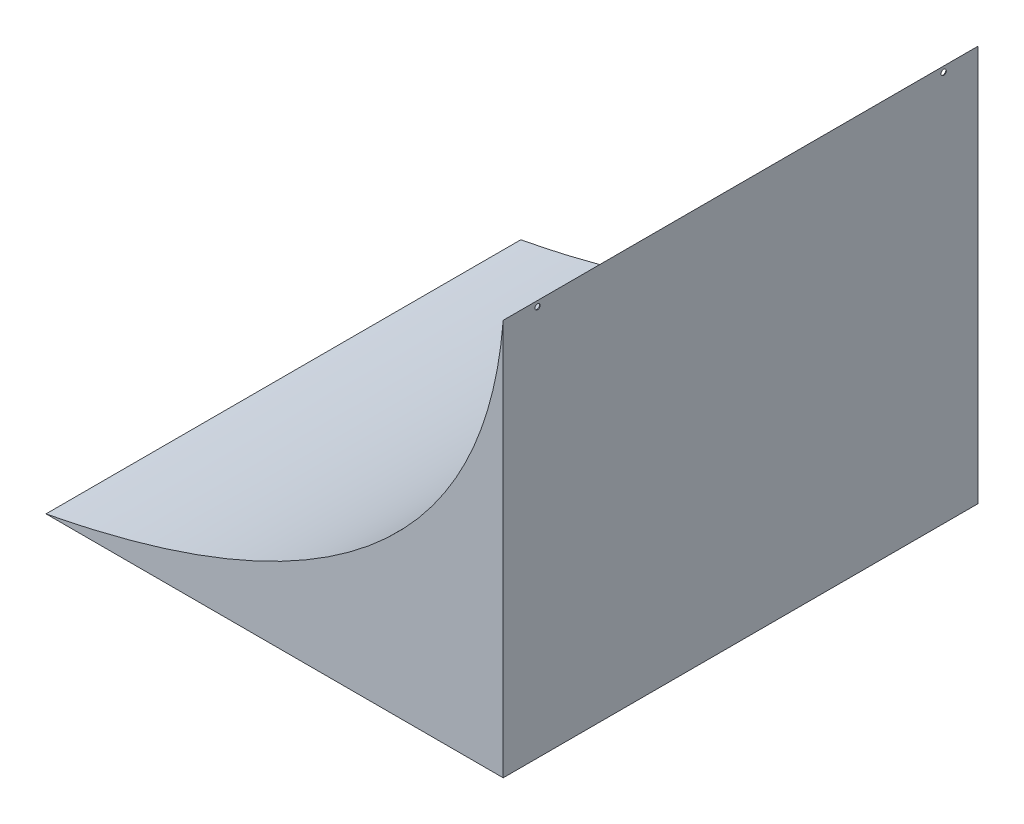
from build123d import *

# Parameters (mm, degrees)
SALIENTE_EXTRUIR1_DEPTH = 270


with BuildPart() as part:
    # Croquis1 → Saliente-Extruir1 (new body)
    with BuildSketch(Plane.XY):
        with BuildLine():
            Line((100.713061676, 115.894152269), (100.713061676, -109.438674176))
            Line((100.713061676, -109.438674176), (-159.286938324, -109.438674176))
            add(Edge.make_bspline(
                [(100.713061676, 115.894152269), (86.491229744, -62.657074826), (-159.286938324, -109.438674176)],
                knots=[0, 0, 0, 1, 1, 1], degree=2))
        make_face()
    extrude(amount=SALIENTE_EXTRUIR1_DEPTH)

    # Cortar-Extruir1: read off the stored shape, not the designer's step
    # Cortar-Extruir1: loft between two sections, ruled curve by curve
    cortar_extruir1_from = [
        Edge.make_three_point_arc((100.303649048, 114.269152269, 250.475), (100.303649048, 112.769152269, 251.975), (100.303649048, 111.269152269, 250.475)),
        Edge.make_three_point_arc((100.303649048, 111.269152269, 250.475), (100.303649048, 112.769152269, 248.975), (100.303649048, 114.269152269, 250.475)),
    ]
    cortar_extruir1_to = [
        Edge.make_three_point_arc((100.713061676, 114.269152269, 250.475), (100.713061676, 112.769152269, 251.975), (100.713061676, 111.269152269, 250.475)),
        Edge.make_three_point_arc((100.713061676, 111.269152269, 250.475), (100.713061676, 112.769152269, 248.975), (100.713061676, 114.269152269, 250.475)),
    ]
    cortar_extruir1 = Solid(Shell([*[Face.make_surface_from_curves(cortar_extruir1_from[k], cortar_extruir1_to[k]) for k in range(2)], Face(Wire(cortar_extruir1_from)), Face(Wire(cortar_extruir1_to))]))
    add(cortar_extruir1, mode=Mode.SUBTRACT)

    # Cortar-Extruir1 2: loft between two sections, ruled curve by curve
    cortar_extruir1_2_from = [
        Edge.make_three_point_arc((100.303649048, 114.269152269, 19.525), (100.303649048, 112.769152269, 21.025), (100.303649048, 111.269152269, 19.525)),
        Edge.make_three_point_arc((100.303649048, 111.269152269, 19.525), (100.303649048, 112.769152269, 18.025), (100.303649048, 114.269152269, 19.525)),
    ]
    cortar_extruir1_2_to = [
        Edge.make_three_point_arc((100.713061676, 114.269152269, 19.525), (100.713061676, 112.769152269, 21.025), (100.713061676, 111.269152269, 19.525)),
        Edge.make_three_point_arc((100.713061676, 111.269152269, 19.525), (100.713061676, 112.769152269, 18.025), (100.713061676, 114.269152269, 19.525)),
    ]
    cortar_extruir1_2 = Solid(Shell([*[Face.make_surface_from_curves(cortar_extruir1_2_from[k], cortar_extruir1_2_to[k]) for k in range(2)], Face(Wire(cortar_extruir1_2_from)), Face(Wire(cortar_extruir1_2_to))]))
    add(cortar_extruir1_2, mode=Mode.SUBTRACT)


solid = part.part
